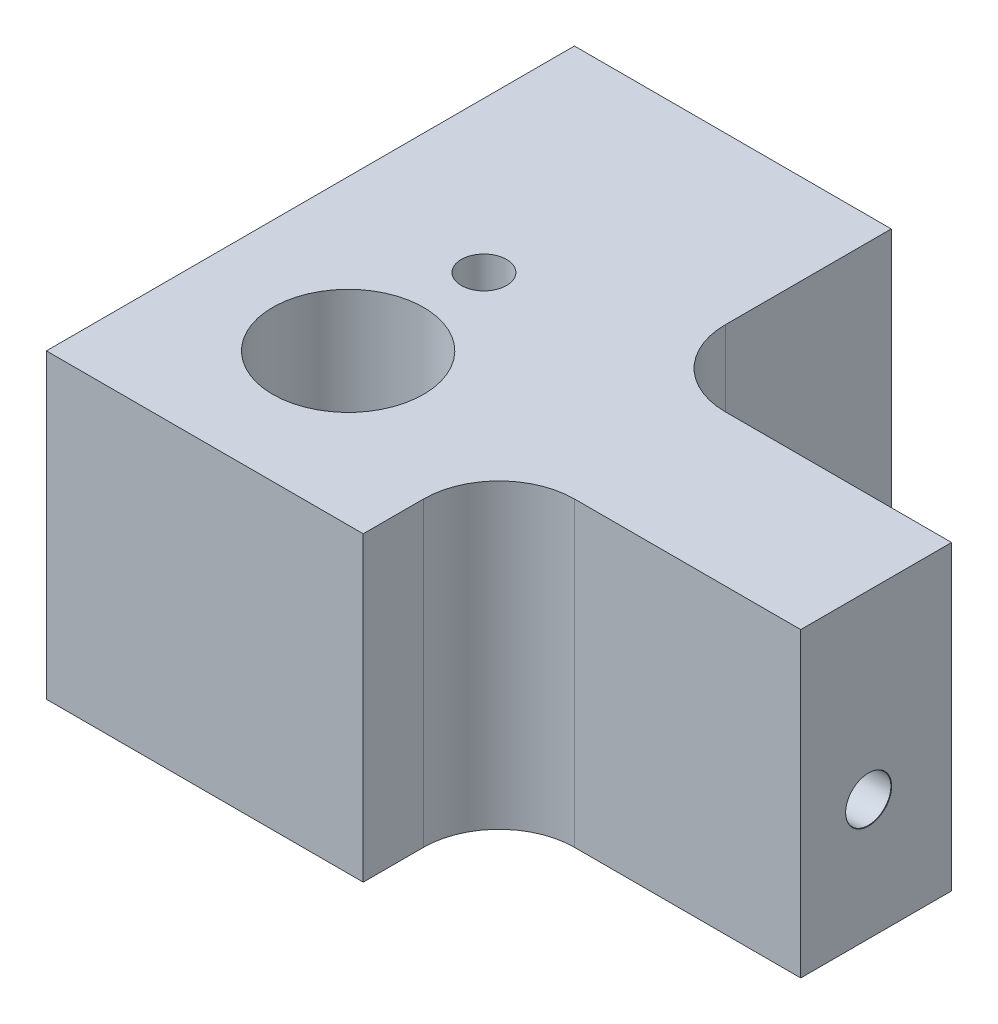
from build123d import *

# Parameters (mm, degrees)
SKETCH1_W                       = 49
SKETCH1_H                       = 35
BOSS_EXTRUDE1_DEPTH             = 20
F_3_0MM_DOWEL_HOLE1_D           = 3
F_3_0MM_DOWEL_HOLE1_DEPTH       = 11.098709071
F_3_0MM_DOWEL_HOLE1_CSINK_D     = 3.05
F_3_0MM_DOWEL_HOLE1_CSINK_ANGLE = 90
F_3_0MM_DOWEL_HOLE1_TIP         = 0.901290929
F_3_0MM_DOWEL_HOLE2_D           = 3
F_3_0MM_DOWEL_HOLE2_DEPTH       = 12
F_3_0MM_DOWEL_HOLE2_CSINK_D     = 3.05
F_3_0MM_DOWEL_HOLE2_CSINK_ANGLE = 90
F_3_0MM_DOWEL_HOLE2_TIP         = 0.901290929
F_3_0MM_DOWEL_HOLE3_D           = 3
F_3_0MM_DOWEL_HOLE3_CSINK_D     = 3.05
F_3_0MM_DOWEL_HOLE3_CSINK_ANGLE = 90
SKETCH14_W                      = 8
SKETCH14_H                      = 35
SKETCH14_W_2                    = 20
SKETCH14_H_2                    = 16
SKETCH14_H_3                    = 9
CUT_EXTRUDE3_DEPTH              = 28
SKETCH15_R                      = 5
CUT_EXTRUDE4_DEPTH              = 30
FILLET1_R                       = 5


with BuildPart() as part:
    # Sketch1 → Boss-Extrude1 (new body)
    with BuildSketch(Plane(origin=(0, 0, 0), x_dir=(1, 0, 0), z_dir=(0, 1, 0))):
        with Locations((13.974428044, 4.809594096)):
            Rectangle(SKETCH1_W, SKETCH1_H)
    extrude(amount=BOSS_EXTRUDE1_DEPTH)

    # Ø3.0mm Dowel Hole1
    with Locations(Plane(origin=(0, 0, -22.309594096), x_dir=(-1, 0, 0), z_dir=(0, 0, -1))):
        with Locations((-7.474428044, 4)):
            CounterSinkHole(F_3_0MM_DOWEL_HOLE1_D / 2, F_3_0MM_DOWEL_HOLE1_CSINK_D / 2, depth=F_3_0MM_DOWEL_HOLE1_DEPTH, counter_sink_angle=F_3_0MM_DOWEL_HOLE1_CSINK_ANGLE)
            with Locations((0, 0, -(F_3_0MM_DOWEL_HOLE1_DEPTH + F_3_0MM_DOWEL_HOLE1_TIP / 2))):  # 118° drill point
                Cone(0, F_3_0MM_DOWEL_HOLE1_D / 2, F_3_0MM_DOWEL_HOLE1_TIP, mode=Mode.SUBTRACT)

    # Ø3.0mm Dowel Hole2
    with Locations(Plane(origin=(38.474428044, 0, 0), x_dir=(0, 0, -1), z_dir=(1, 0, 0))):
        with Locations((0.809594096, 8)):
            CounterSinkHole(F_3_0MM_DOWEL_HOLE2_D / 2, F_3_0MM_DOWEL_HOLE2_CSINK_D / 2, depth=F_3_0MM_DOWEL_HOLE2_DEPTH, counter_sink_angle=F_3_0MM_DOWEL_HOLE2_CSINK_ANGLE)
            with Locations((0, 0, -(F_3_0MM_DOWEL_HOLE2_DEPTH + F_3_0MM_DOWEL_HOLE2_TIP / 2))):  # 118° drill point
                Cone(0, F_3_0MM_DOWEL_HOLE2_D / 2, F_3_0MM_DOWEL_HOLE2_TIP, mode=Mode.SUBTRACT)

    # Ø3.0mm Dowel Hole3 (through all)
    with Locations(Plane(origin=(0, 0, 0), x_dir=(-1, 0, 0), z_dir=(0, -1, 0))):
        with Locations((-7.474428044, 6.309594096)):
            CounterSinkHole(F_3_0MM_DOWEL_HOLE3_D / 2, F_3_0MM_DOWEL_HOLE3_CSINK_D / 2, counter_sink_angle=F_3_0MM_DOWEL_HOLE3_CSINK_ANGLE)

    # Sketch14 → Cut-Extrude3 (cut)
    with BuildSketch(Plane(origin=(0, 20, 0), x_dir=(1, 0, 0), z_dir=(0, 1, 0))):
        with Locations((-6.525571956, 4.809594096)):
            Rectangle(SKETCH14_W, SKETCH14_H)
        with Locations((28.474428044, 14.309594096)):
            Rectangle(SKETCH14_W_2, SKETCH14_H_2)
        with Locations((28.474428044, -8.190405904)):
            Rectangle(SKETCH14_W_2, SKETCH14_H_3)
    extrude(amount=-CUT_EXTRUDE3_DEPTH, mode=Mode.SUBTRACT)

    # Sketch15 → Cut-Extrude4 (cut)
    with BuildSketch(Plane(origin=(0, 20, 0), x_dir=(1, 0, 0), z_dir=(0, 1, 0))):
        with Locations((7.474428044, -2.690405904)):
            Circle(SKETCH15_R)
    extrude(amount=-CUT_EXTRUDE4_DEPTH, mode=Mode.SUBTRACT)

    # Fillet1
    fillet1_edges = [part.edges().sort_by_distance(p)[0] for p in [
        (18.474428044, 10, 3.690405904),
        (18.474428044, 10, -6.309594096),
    ]]
    fillet(fillet1_edges, radius=FILLET1_R)


solid = part.part
